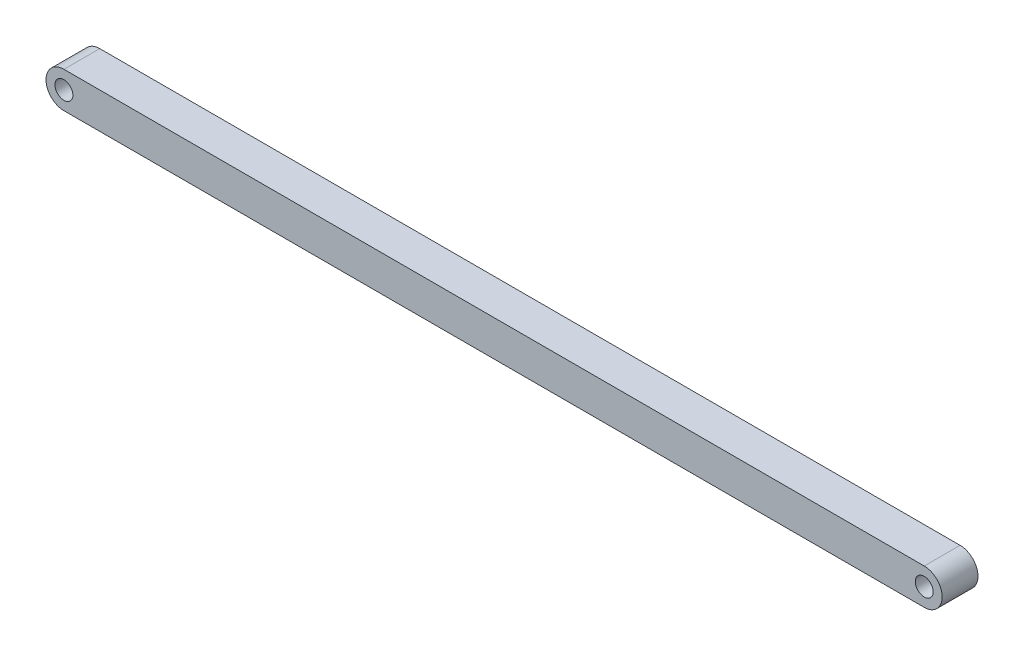
from build123d import *

# Parameters (mm, degrees)
BOSS_EXTRUDE1_DEPTH = 12.7
SKETCH2_R           = 6.35
CUT_EXTRUDE1_DEPTH  = 319.767470109


with BuildPart() as part:
    # Sketch1 → Boss-Extrude1 (new, symmetric)
    with BuildSketch(Plane.XY):
        with BuildLine():
            Line((-304.8, 12.7), (304.8, 12.7))
            ThreePointArc((304.8, 12.7), (317.5, 0), (304.8, -12.7))
            Line((304.8, -12.7), (-304.8, -12.7))
            ThreePointArc((-304.8, -12.7), (-317.5, 0), (-304.8, 12.7))
        make_face()
    extrude(amount=BOSS_EXTRUDE1_DEPTH, both=True)

    # Sketch2 → Cut-Extrude1 (cut, through all)
    with BuildSketch(Plane.XY.offset(12.7)):
        with Locations((-304.8, 0)):
            Circle(SKETCH2_R)
        with Locations((304.8, 0)):
            Circle(SKETCH2_R)
    extrude(amount=-CUT_EXTRUDE1_DEPTH, mode=Mode.SUBTRACT)


solid = part.part
